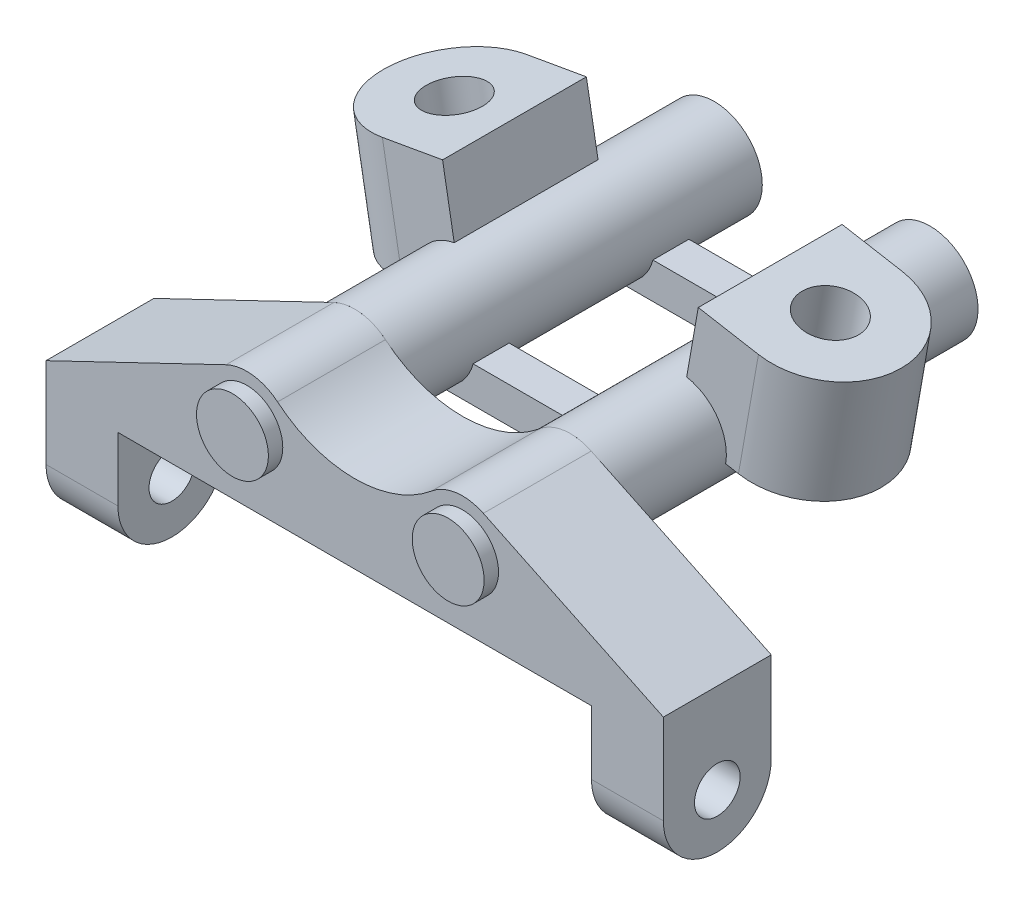
from build123d import *

# Parameters (mm, degrees)
BOSS_EXTRUDE1_DEPTH  = 15
SKETCH2_R            = 5
BOSS_EXTRUDE2_DEPTH  = 2
FILLET1_R            = 7.5
SKETCH3_R            = 3.175
CUT_EXTRUDE1_DEPTH   = 98.956959446
SKETCH6_R            = 6.681774697
SKETCH6_R_2          = 6.68278568
BOSS_EXTRUDE12_DEPTH = 50
SKETCH7_W            = 30
SKETCH7_H            = 5
BOSS_EXTRUDE13_DEPTH = 5
BOSS_EXTRUDE14_DEPTH = 20
CUT_EXTRUDE2_DEPTH   = 80.803575914
CUT_EXTRUDE3_DEPTH   = 80.803575914
SKETCH14_R           = 3.96875
CUT_EXTRUDE5_DEPTH   = 12.7
SKETCH15_R           = 3.96875
CUT_EXTRUDE6_DEPTH   = 12.7
CUT_EXTRUDE7_DEPTH   = 65.852


with BuildPart() as part:
    # Sketch1 → Boss-Extrude1 (new body)
    with BuildSketch(Plane.XY):
        with BuildLine():
            Line((-42.926, -44), (-32.926, -44))
            Line((-32.926, -44), (-32.926, -28.710188268))
            Line((-32.926, -28.710188268), (32.926, -28.710188268))
            Line((32.926, -28.710188268), (32.926, -44))
            Line((32.926, -44), (42.926, -44))
            Line((42.926, -44), (42.926, -24))
            Line((42.926, -24), (17.891154449, -11.978277245))
            ThreePointArc((17.891154449, -11.978277245), (14.176193126, -11.370797146), (10.722524758, -12.86817636))
            ThreePointArc((10.722524758, -12.86817636), (-0.000433641, -16.749999994), (-10.723191032, -12.867621151))
            ThreePointArc((-10.723191032, -12.867621151), (-14.17767847, -11.369790059), (-17.893538872, -11.977542403))
            Line((-17.893538872, -11.977542403), (-42.926, -24))
            Line((-42.926, -24), (-42.926, -44))
        make_face()
    extrude(amount=BOSS_EXTRUDE1_DEPTH)

    # Sketch2 → Boss-Extrude2 (add)
    with BuildSketch(Plane.XY.offset(15)):
        with Locations((-15.00078962, -18.000656449)):
            Circle(SKETCH2_R)
        with Locations((14.99921038, -18.000656449)):
            Circle(SKETCH2_R)
    extrude(amount=BOSS_EXTRUDE2_DEPTH)

    # Fillet1
    fillet1_edges = [part.edges().sort_by_distance(p)[0] for p in [
        (37.926, -44, 0),
        (37.926, -44, 15),
        (-37.926, -44, 0),
        (-37.926, -44, 15),
    ]]
    fillet(fillet1_edges, radius=FILLET1_R - 0.0001)  # a hair under: the kernel refuses the full size

    # Sketch3 → Cut-Extrude1 (cut, through all)
    with BuildSketch(Plane(origin=(42.926, 0, 0), x_dir=(0, 0, -1), z_dir=(1, 0, 0))):
        with Locations((-7.5, -36.5)):
            Circle(SKETCH3_R)
    extrude(amount=-CUT_EXTRUDE1_DEPTH, mode=Mode.SUBTRACT)

    # Sketch6 → Boss-Extrude12 (add)
    with BuildSketch(Plane(origin=(0, 0, 0), x_dir=(1, 0, 0), z_dir=(0, 0, -1))):
        with Locations(Location((15, 18, 0), (0, 0, 229.345625522))):
            Circle(SKETCH6_R)
        with Locations(Location((-15, 18, 0), (0, 0, 311.001557714))):
            Circle(SKETCH6_R_2)
    extrude(amount=BOSS_EXTRUDE12_DEPTH)

    # Sketch7 → Boss-Extrude13 (add)
    with BuildSketch(Plane(origin=(0.000831779, -24.682280164, 0), x_dir=(-0.9999999994321744, -3.369942598152246e-05, 0), z_dir=(3.369942598152246e-05, -0.9999999994321744, 0))):
        with Locations((0, 37.5)):
            Rectangle(SKETCH7_W, SKETCH7_H)
        with Locations((0, 12.5)):
            Rectangle(SKETCH7_W, SKETCH7_H)
    extrude(amount=-BOSS_EXTRUDE13_DEPTH)

    # Sketch8 → Boss-Extrude14 (add)
    with BuildSketch(Plane(origin=(0, 0, -15), x_dir=(-1, 0, 0), z_dir=(0, 0, -1))):
        Polygon((-15, -18), (-33.218220182, -21.212363759), (-35.996591025, -5.45543971), (-17.778370843, -2.243075952), align=None)
        Polygon((15, -18), (33.218220182, -21.212363759), (35.996591025, -5.45543971), (17.778370843, -2.243075952), align=None)
    extrude(amount=BOSS_EXTRUDE14_DEPTH)

    # Sketch9 → Cut-Extrude2 (cut, through all)
    with BuildSketch(Plane(origin=(0.152494897, 0.864841536, 0), x_dir=(0.9848077530122067, -0.17364817766693838, 0), z_dir=(0.17364817766693838, 0.9848077530122067, 0))):
        with BuildLine():
            Line((36.397049088, 35), (26.397049088, 35))
            ThreePointArc((26.397049088, 35), (33.46811688, 32.071067832), (36.397049088, 25.000000057))
            Line((36.397049088, 25.000000057), (36.397049088, 35))
        make_face()
        with BuildLine():
            Line((36.397049088, 15), (36.397049088, 25.000000057))
            ThreePointArc((36.397049088, 25.000000057), (33.46811692, 17.928932208), (26.397049088, 15))
            Line((26.397049088, 15), (36.397049088, 15))
        make_face()
    extrude(amount=-CUT_EXTRUDE2_DEPTH, mode=Mode.SUBTRACT)

    # Sketch10 → Cut-Extrude3 (cut, through all)
    with BuildSketch(Plane(origin=(-0.152494897, 0.864841536, 0), x_dir=(0.9848077530122081, 0.1736481776669306, 0), z_dir=(-0.1736481776669306, 0.9848077530122081, 0))):
        with BuildLine():
            Line((-26.397049088, 35), (-38.349952552, 35))
            Line((-38.349952552, 35), (-38.349952552, 15))
            Line((-38.349952552, 15), (-26.397049088, 15))
            ThreePointArc((-26.397049088, 15), (-36.397049088, 25), (-26.397049088, 35))
        make_face()
    extrude(amount=-CUT_EXTRUDE3_DEPTH, mode=Mode.SUBTRACT)

    # Sketch14 → Cut-Extrude5 (cut)
    with BuildSketch(Plane(origin=(0.152494897, 0.864841536, 0), x_dir=(0.9848077530122067, -0.17364817766693838, 0), z_dir=(0.17364817766693838, 0.9848077530122067, 0))):
        with Locations(Location((26.397049088, 25, 0), (0, 0, 180))):
            Circle(SKETCH14_R)
    extrude(amount=-CUT_EXTRUDE5_DEPTH, mode=Mode.SUBTRACT)

    # Sketch15 → Cut-Extrude6 (cut)
    with BuildSketch(Plane(origin=(-0.152494897, 0.864841536, 0), x_dir=(0.9848077530122081, 0.1736481776669306, 0), z_dir=(-0.1736481776669306, 0.9848077530122081, 0))):
        with Locations(Location((-26.397049088, 25, 0), (0, 0, 180))):
            Circle(SKETCH15_R)
    extrude(amount=-CUT_EXTRUDE6_DEPTH, mode=Mode.SUBTRACT)

    # Sketch16 → Cut-Extrude7 (cut)
    with BuildSketch(Plane(origin=(-32.926, 0, 0), x_dir=(0, 0, -1), z_dir=(1, 0, 0))):
        with BuildLine():
            Line((-1.30209294, -27.639011629), (0, -27.639011629))
            Line((0, -27.639011629), (0, -30.25))
            Line((0, -30.25), (-15, -30.25))
            Line((-15, -30.25), (-15, -27.639011629))
            Line((-15, -27.639011629), (-13.69790706, -27.639011629))
            ThreePointArc((-13.69790706, -27.639011629), (-7.5, -25.686528456), (-1.30209294, -27.639011629))
        make_face()
    extrude(amount=CUT_EXTRUDE7_DEPTH, mode=Mode.SUBTRACT)


solid = part.part
